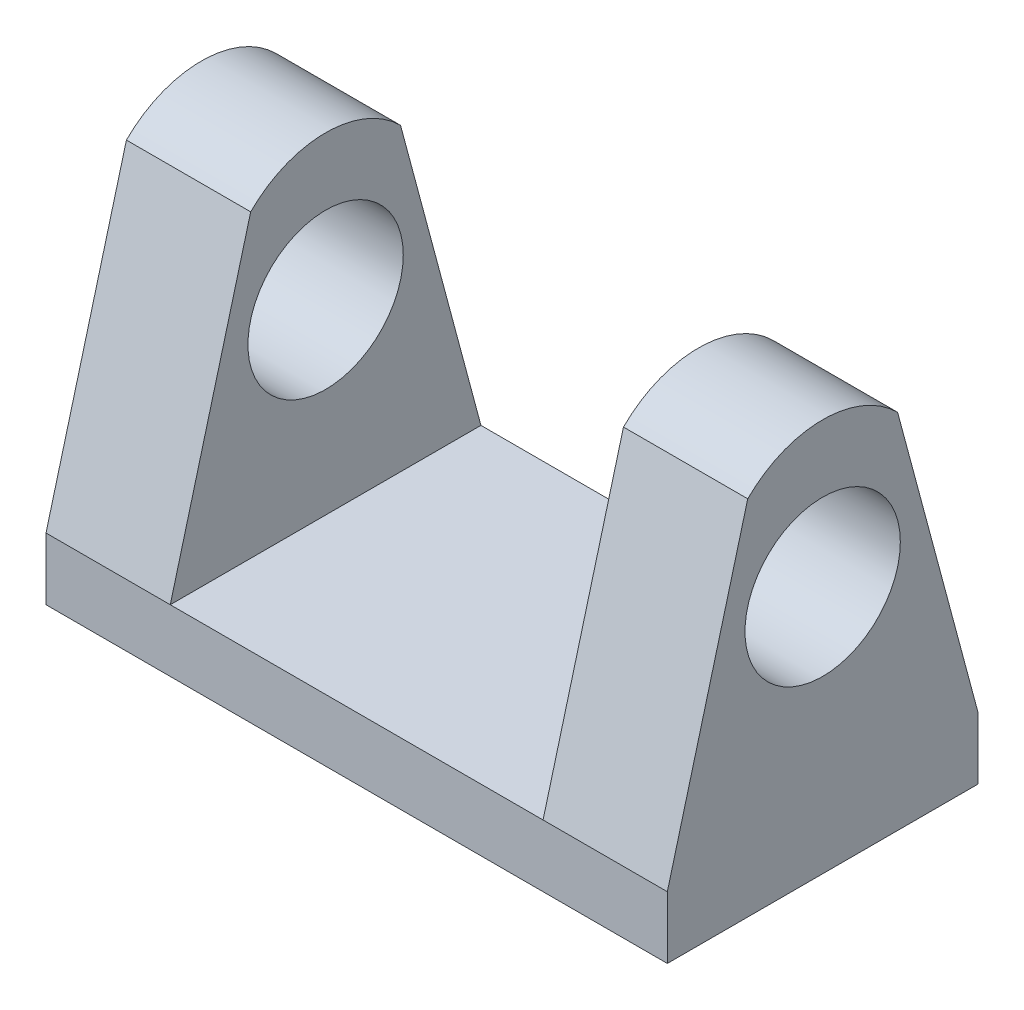
from build123d import *

# Parameters (mm, degrees)
SKETCH1_W           = 25.4
SKETCH1_H           = 12.7
BOSS_EXTRUDE1_DEPTH = 2.54
BOSS_EXTRUDE2_DEPTH = 5.08
SKETCH3_R           = 3.175
CUT_EXTRUDE1_DEPTH  = 31.723282092


with BuildPart() as part:
    # Sketch1 → Boss-Extrude1 (new body)
    with BuildSketch(Plane(origin=(0, 0, 0), x_dir=(1, 0, 0), z_dir=(0, 1, 0))):
        Rectangle(SKETCH1_W, SKETCH1_H)
    extrude(amount=BOSS_EXTRUDE1_DEPTH)

    # Sketch2 → Boss-Extrude2 (add)
    with BuildSketch(Plane(origin=(12.7, 0, 0), x_dir=(0, 0, -1), z_dir=(1, 0, 0))):
        with BuildLine():
            Line((-6.35, 2.54), (-3.062998127, 14.807257994))
            ThreePointArc((-3.062998127, 14.807257994), (0, 16.07599336), (3.062998127, 14.807257994))
            Line((3.062998127, 14.807257994), (6.35, 2.54))
            Line((6.35, 2.54), (-6.35, 2.54))
        make_face()
    boss_extrude2 = extrude(amount=-BOSS_EXTRUDE2_DEPTH)

    # Mirror1: Boss-Extrude2 across plane
    add(boss_extrude2.mirror(Plane(origin=(0, 0, 0), x_dir=(0, 0, 1), z_dir=(1, 0, 0))))

    # Sketch3 → Cut-Extrude1 (cut, through all)
    with BuildSketch(Plane(origin=(12.7, 0, 0), x_dir=(0, 0, -1), z_dir=(1, 0, 0))):
        with Locations((0, 10.16)):
            Circle(SKETCH3_R)
    extrude(amount=-CUT_EXTRUDE1_DEPTH, mode=Mode.SUBTRACT)


solid = part.part
